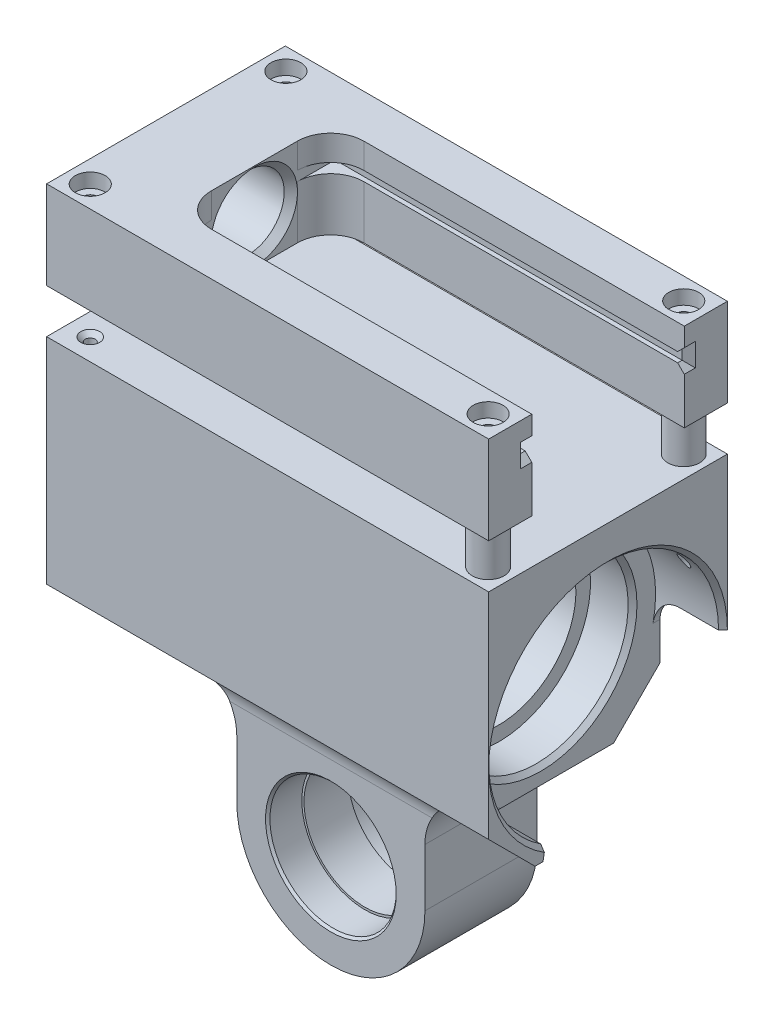
from build123d import *
from OCP.BRepFilletAPI import BRepFilletAPI_MakeFillet

# Parameters (mm, degrees)
SKETCH2_R                                   = 14.28
BOSS_EXTRUDE1_DEPTH                         = 12.7
SKETCH4_W                                   = 100
SKETCH4_H                                   = 59
BOSS_EXTRUDE2_DEPTH                         = 27
SKETCH3_R                                   = 17.5
CUT_EXTRUDE1_DEPTH                          = 134.360413917
SKETCH5_R                                   = 14.28
SKETCH5_R_2                                 = 13.78
BOSS_EXTRUDE3_DEPTH                         = 5
FILLET1_R1                                  = 12
FILLET1_R2                                  = 6
CUT_EXTRUDE2_DEPTH                          = 15.24
SKETCH7_W                                   = 54
SKETCH7_H                                   = 19.938
BOSS_EXTRUDE6_DEPTH                         = 20
BOSS_EXTRUDE7_DEPTH                         = 80
CBORE_FOR_4_BINDING_HEAD_MACHINE_SC_2_COUNT = 2
CBORE_FOR_4_BINDING_HEAD_MACHINE_SC_2_PITCH = 44.25
CBORE_FOR_4_BINDING_HEAD_MACHINE_SC_3_COUNT = 2
CBORE_FOR_4_BINDING_HEAD_MACHINE_SC_3_PITCH = 100.289892312
CBORE_FOR_4_BINDING_HEAD_MACHINE_SC_4_COUNT = 2
CBORE_FOR_4_BINDING_HEAD_MACHINE_SC_4_PITCH = 90
F_4_40_START                                = 60
F_4_40_TAPPED_HOLE1_OUTLINE_R               = 1.1303
F_4_40_TAPPED_HOLE1_DEPTH                   = 25
FILLET2_R                                   = 7.5
SKETCH15_R                                  = 20.7883
CUT_EXTRUDE3_DEPTH                          = 9.525
CHAMFER1_SIZE                               = 1
CUT_EXTRUDE4_START                          = -1.6
SKETCH16_R                                  = 8.25
CUT_EXTRUDE4_DEPTH                          = 153.383336319
SKETCH17_R                                  = 9.165522347
SKETCH17_R_2                                = 3.75
BOSS_EXTRUDE8_DEPTH                         = 1.6
SKETCH18_R                                  = 1
CUT_EXTRUDE5_DEPTH                          = 154.983336319
CHAMFER5_SIZE                               = 1.5
CHAMFER6_SIZE                               = 1.5
FILLET3_R                                   = 5.5
CHAMFER7_SIZE                               = 5.992013882
CHAMFER7_SIZE_2                             = 6
FILLET4_R                                   = 5.5
CHAMFER8_SIZE                               = 1
CHAMFER10_SIZE                              = 1
CHAMFER11_SIZE                              = 0.5
SKETCH19_R                                  = 3.6
SKETCH19_R_2                                = 1.6
BOSS_EXTRUDE9_DEPTH                         = 10
BOSS_EXTRUDE9_2_DEPTH                       = 10


with BuildPart() as part:
    # Sketch2 → Boss-Extrude1 (new, symmetric)
    with BuildSketch(Plane.XY):
        with BuildLine():
            Line((-21.28, 0), (-21.28, 82.28))
            Line((-21.28, 82.28), (21.28, 82.28))
            Line((21.28, 82.28), (21.28, 0))
            ThreePointArc((21.28, 0), (0, -21.28), (-21.28, 0))
        make_face()
        Circle(SKETCH2_R, mode=Mode.SUBTRACT)
    extrude(amount=BOSS_EXTRUDE1_DEPTH, both=True)

    # Sketch4 → Boss-Extrude2 (add, symmetric)
    with BuildSketch(Plane.XY):
        with Locations((0, 54.5)):
            Rectangle(SKETCH4_W, SKETCH4_H)
    extrude(amount=BOSS_EXTRUDE2_DEPTH, both=True)

    # Sketch3 → Cut-Extrude1 (cut, through all)
    with BuildSketch(Plane(origin=(50, 0, 0), x_dir=(0, 0, -1), z_dir=(1, 0, 0))):
        with Locations((0, 49.5)):
            Circle(SKETCH3_R)
    extrude(amount=-CUT_EXTRUDE1_DEPTH, mode=Mode.SUBTRACT)

    # Sketch5 → Boss-Extrude3 (add, symmetric)
    with BuildSketch(Plane.XY):
        Circle(SKETCH5_R)
        Circle(SKETCH5_R_2, mode=Mode.SUBTRACT)
    extrude(amount=BOSS_EXTRUDE3_DEPTH, both=True)

    # Fillet1: one fillet with a radius per group of edges: ONE call of the kernel's fillet builder (fillet() takes one radius for all edges)
    fillet1_edges_1 = [part.edges().sort_by_distance(p)[0] for p in [
        (-21.28, 25, 0),
        (21.28, 25, 0),
    ]]
    fillet1_edges_2 = [part.edges().sort_by_distance(p)[0] for p in [
        (0, 25, 12.7),
        (0, 25, -12.7),
    ]]
    fillet1 = BRepFilletAPI_MakeFillet(part.part.solid().wrapped)
    for e in fillet1_edges_1:
        fillet1.Add(FILLET1_R1, e.wrapped)
    for e in fillet1_edges_2:
        fillet1.Add(FILLET1_R2, e.wrapped)
    add(Compound.cast(fillet1.Shape()), mode=Mode.REPLACE)

    # Sketch6 → Cut-Extrude2 (cut)
    with BuildSketch(Plane.ZY.offset(50)):
        with BuildLine():
            Line((0, 23.5), (0, -0.612195027))
            Line((0, -0.612195027), (-26, -0.612195027))
            Line((-26, -0.612195027), (-31.032905967, -0.612195027))
            Line((-31.032905967, -0.612195027), (-31.032905967, 49.5))
            Line((-31.032905967, 49.5), (-26, 49.5))
            ThreePointArc((-26, 49.5), (18.384776311, 67.884776311), (0, 23.5))
        make_face()
    cut_extrude2 = extrude(amount=-CUT_EXTRUDE2_DEPTH, mode=Mode.SUBTRACT)

    # Mirror1: Cut-Extrude2 across plane
    add(cut_extrude2.mirror(Plane(origin=(0, 0, 0), x_dir=(0, 0, 1), z_dir=(1, 0, 0))), mode=Mode.SUBTRACT)

    # #4-40 Tapped Hole1: read off the stored shape, not the designer's step
    # #4-40 Tapped Hole1 outline → #4-40 Tapped Hole1 (cut)
    with BuildSketch(Plane(origin=(0, 0, 0), x_dir=(1, 0, 0), z_dir=(0, 1, 0)).offset(F_4_40_START)):
        with Locations((45, -22.125)):
            Circle(F_4_40_TAPPED_HOLE1_OUTLINE_R)
        with Locations((45, 22.125)):
            Circle(F_4_40_TAPPED_HOLE1_OUTLINE_R)
        with Locations((-45, -22.125)):
            Circle(F_4_40_TAPPED_HOLE1_OUTLINE_R)
        with Locations((-45, 22.125)):
            Circle(F_4_40_TAPPED_HOLE1_OUTLINE_R)
    extrude(amount=F_4_40_TAPPED_HOLE1_DEPTH, mode=Mode.SUBTRACT)

    # Sketch15 → Cut-Extrude3 (cut)
    with BuildSketch(Plane(origin=(34.76, 0, 0), x_dir=(0, 0, -1), z_dir=(1, 0, 0))):
        with Locations(Location((0, 49.5, 0), (0, 0, 90))):
            Circle(SKETCH15_R)
    cut_extrude3 = extrude(amount=-CUT_EXTRUDE3_DEPTH, mode=Mode.SUBTRACT)

    # Mirror2: Cut-Extrude3 across plane
    add(cut_extrude3.mirror(Plane(origin=(0, 0, 0), x_dir=(0, 0, 1), z_dir=(1, 0, 0))), mode=Mode.SUBTRACT)

    # Chamfer1
    chamfer1_edges = [part.edges().sort_by_distance(p)[0] for p in [
        (34.76, 28.7117, 0),
        (-34.76, 28.7117, 0),
    ]]
    chamfer(chamfer1_edges, length=CHAMFER1_SIZE)

    # Chamfer3
    # the kernel refuses this chamfer: 10.5 mm, written as the material it takes off along each edge
    with BuildSketch(Plane(origin=(82.302052332, 25, 27), x_dir=(0, 0, -1), z_dir=(-1, 0, 0))) as chamfer3_piece_1:
        with BuildLine():
            Line((12.727386361, 2.227386361), (-2.227386361, -12.727386361))
            Line((-2.227386361, -12.727386361), (-3.802386361, -12.727386361))
            ThreePointArc((-3.802386361, -12.727386361), (-1.575, -6.36369318), (-1.575, 0))
            Line((-1.575, 0), (0, 1.575))
            ThreePointArc((0, 1.575), (6.36369318, 1.575), (12.727386361, 3.802386361))
            Line((12.727386361, 3.802386361), (12.727386361, 2.227386361))
        make_face()
    extrude(amount=164.604104664, mode=Mode.SUBTRACT)
    with BuildSketch(Plane(origin=(67.062052332, 25, -27), x_dir=(0, 0, 1), z_dir=(-1, 0, 0))) as chamfer3_piece_2:
        with BuildLine():
            Line((12.727386361, -2.227386361), (-2.227386361, 12.727386361))
            Line((-2.227386361, 12.727386361), (-3.802386361, 12.727386361))
            ThreePointArc((-3.802386361, 12.727386361), (-1.575, 6.36369318), (-1.575, 0))
            Line((-1.575, 0), (0, -1.575))
            ThreePointArc((0, -1.575), (6.36369318, -1.575), (12.727386361, -3.802386361))
            Line((12.727386361, -3.802386361), (12.727386361, -2.227386361))
        make_face()
    extrude(amount=134.124104664, mode=Mode.SUBTRACT)

    # Fillet3
    fillet3_edges = [part.edges().sort_by_distance(p)[0] for p in [
        (-34.76, 49.5, -26.5),
        (34.76, 49.5, -26.5),
    ]]
    fillet(fillet3_edges, radius=FILLET3_R)

    # Chamfer7
    # the kernel refuses this chamfer: 6, 5.992013882 mm, written as the material it takes off along each edge
    with BuildSketch(Plane(origin=(-34.76, 25, 8.703447593), x_dir=(0, 0, 1), z_dir=(-1, 0, 0))) as chamfer7_piece_1:
        with BuildLine():
            Line((CHAMFER7_SIZE, 0), (5.530305418, 2.742236438))
            ThreePointArc((5.530305418, 2.742236438), (2.878279334, 1.222036142), (0, 0))
            Line((0, 0), (CHAMFER7_SIZE, 0))
        make_face()
    extrude(amount=30.856297971, mode=Mode.SUBTRACT)
    with BuildSketch(Plane(origin=(34.76, 25, 8.703447593), x_dir=(0, 0, 1), z_dir=(1, 0, 0))) as chamfer7_piece_2:
        with BuildLine():
            Line((CHAMFER7_SIZE_2, 0), (5.517899842, -2.734125859))
            ThreePointArc((5.517899842, -2.734125859), (2.870808424, -1.218320557), (0, 0))
            Line((0, 0), (CHAMFER7_SIZE_2, 0))
        make_face()
    extrude(amount=30.81497635, mode=Mode.SUBTRACT)

    # Fillet4
    fillet4_edges = [part.edges().sort_by_distance(p)[0] for p in [
        (-34.76, 26.371118219, 14.464607243),
        (34.76, 26.367062929, 14.462397514),
    ]]
    fillet(fillet4_edges, radius=FILLET4_R)

    # Chamfer8
    chamfer8_edges = [part.edges().sort_by_distance(p)[0] for p in [
        (50, 72.366515184, 12.374266982),
        (-50, 72.370041302, 12.367748819),
    ]]
    chamfer(chamfer8_edges, length=CHAMFER8_SIZE - 0.0001)  # a hair under: the kernel refuses the full size

    # Chamfer10
    chamfer10_edges = [part.edges().sort_by_distance(p)[0] for p in [
        (43.8697, 84, 22.125),
        (43.8697, 84, -22.125),
        (-46.1303, 84, 22.125),
        (-46.1303, 84, -22.125),
    ]]
    chamfer(chamfer10_edges, length=CHAMFER10_SIZE)

    # Chamfer11
    chamfer11_edges = [part.edges().sort_by_distance(p)[0] for p in [
        (-14.28, 0, -12.7),
        (-14.28, 0, 12.7),
    ]]
    chamfer(chamfer11_edges, length=CHAMFER11_SIZE)


with BuildPart() as body_2:
    # Sketch7 → Boss-Extrude6 (new body)
    with BuildSketch(Plane.ZY.offset(50)):
        with Locations((0, 103.969)):
            Rectangle(SKETCH7_W, SKETCH7_H)
        with BuildLine():
            Line((4.938324412, 109.938), (-4.938324412, 109.938))
            ThreePointArc((-4.938324412, 109.938), (-7.747, 103.969), (-4.938324412, 98))
            Line((-4.938324412, 98), (4.938324412, 98))
            ThreePointArc((4.938324412, 98), (7.747, 103.969), (4.938324412, 109.938))
        make_face(mode=Mode.SUBTRACT)
    extrude(amount=-BOSS_EXTRUDE6_DEPTH)

    # Sketch8 → Boss-Extrude7 (add)
    with BuildSketch(Plane(origin=(-30, 0, 0), x_dir=(0, 0, -1), z_dir=(1, 0, 0))):
        Polygon((27, 94), (27, 113.938), (17.25, 113.938), (17.25, 108.2), (18.25, 108.2), (18.25, 106), (17.25, 106), (17.25, 94), align=None)
        Polygon((-17.25, 94), (-27, 94), (-27, 113.938), (-17.25, 113.938), (-17.25, 108.2), (-18.25, 108.2), (-18.25, 106), (-17.25, 106), align=None)
    extrude(amount=BOSS_EXTRUDE7_DEPTH)

    # Sketch11 → CBORE for #4 Binding Head Machine Screw1 (revolve, cut)
    with BuildSketch(Plane(origin=(-45, 113.938, -22.125), x_dir=(0, 0, 1), z_dir=(1, 0, 0))):
        Polygon((0, 0), (0, 30.917574487), (1.63195, 29.937), (1.63195, 3.227197), (3.37312, 3.227197), (3.37312, 0), align=None)
    cbore_for_4_binding_head_machine_screw1 = revolve(axis=Axis((-45, 120.288, -22.125), (0, -1, 0)), mode=Mode.SUBTRACT)

    # CBORE for _4 Binding Head Machine Sc 2: CBORE for #4 Binding Head Machine Screw1 ×2
    with Locations(*[(0, 0, i * CBORE_FOR_4_BINDING_HEAD_MACHINE_SC_2_PITCH) for i in range(1, CBORE_FOR_4_BINDING_HEAD_MACHINE_SC_2_COUNT)]):
        add(cbore_for_4_binding_head_machine_screw1, mode=Mode.SUBTRACT)

    # CBORE for _4 Binding Head Machine Sc 3: CBORE for #4 Binding Head Machine Screw1 ×2
    with Locations(*[Vector(0.8973985107073343, 0, 0.44122093443110605) * (i * CBORE_FOR_4_BINDING_HEAD_MACHINE_SC_3_PITCH) for i in range(1, CBORE_FOR_4_BINDING_HEAD_MACHINE_SC_3_COUNT)]):
        add(cbore_for_4_binding_head_machine_screw1, mode=Mode.SUBTRACT)

    # CBORE for _4 Binding Head Machine Sc 4: CBORE for #4 Binding Head Machine Screw1 ×2
    with Locations(*[(i * CBORE_FOR_4_BINDING_HEAD_MACHINE_SC_4_PITCH, 0, 0) for i in range(1, CBORE_FOR_4_BINDING_HEAD_MACHINE_SC_4_COUNT)]):
        add(cbore_for_4_binding_head_machine_screw1, mode=Mode.SUBTRACT)

    # Fillet2
    fillet2_edges = [body_2.edges().sort_by_distance(p)[0] for p in [
        (-30, 100, -17.25),
        (-30, 100, 17.25),
        (-30, 111.069, 17.25),
        (-30, 111.069, -17.25),
    ]]
    fillet(fillet2_edges, radius=FILLET2_R)

    # Sketch16 → Cut-Extrude4 (cut, through all)
    with BuildSketch(Plane.ZY.offset(50).offset(CUT_EXTRUDE4_START)):
        with Locations((0, 103.969)):
            Circle(SKETCH16_R)
    extrude(amount=-CUT_EXTRUDE4_DEPTH, mode=Mode.SUBTRACT)

    # Sketch17 → Boss-Extrude8 (add)
    with BuildSketch(Plane.ZY.offset(50)):
        with Locations((0, 103.969)):
            Circle(SKETCH17_R)
        with Locations((0, 103.969)):
            Circle(SKETCH17_R_2, mode=Mode.SUBTRACT)
    extrude(amount=-BOSS_EXTRUDE8_DEPTH)

    # Sketch18 → Cut-Extrude5 (cut, through all)
    with BuildSketch(Plane.ZY.offset(50)):
        with Locations((5.5, 103.969)):
            Circle(SKETCH18_R)
        with Locations((-5.5, 103.969)):
            Circle(SKETCH18_R)
    extrude(amount=-CUT_EXTRUDE5_DEPTH, mode=Mode.SUBTRACT)

    # Chamfer5
    chamfer5_edges = [body_2.edges().sort_by_distance(p)[0] for p in [
        (50, 106, -17.75),
        (50, 107.1, -18.25),
        (50, 108.2, -17.75),
        (50, 108.2, 17.75),
        (50, 107.1, 18.25),
        (50, 106, 17.75),
    ]]
    chamfer(chamfer5_edges, length=CHAMFER5_SIZE)

    # Chamfer6
    chamfer6_edges = [body_2.edges().sort_by_distance(p)[0] for p in [
        (-30, 103.969, -8.25),
    ]]
    chamfer(chamfer6_edges, length=CHAMFER6_SIZE - 0.0001)  # a hair under: the kernel refuses the full size


with BuildPart() as body_3:
    # Sketch19 → Boss-Extrude9 (new body)
    with BuildSketch(Plane(origin=(0, 84, 0), x_dir=(1, 0, 0), z_dir=(0, 1, 0))):
        with Locations(Location((45, -22.125, 0), (0, 0, 90))):
            Circle(SKETCH19_R)
        with Locations(Location((45, -22.125, 0), (0, 0, 90))):
            Circle(SKETCH19_R_2, mode=Mode.SUBTRACT)
    extrude(amount=BOSS_EXTRUDE9_DEPTH)


with BuildPart() as body_4:
    # Sketch19 → Boss-Extrude9 2 (new body)
    with BuildSketch(Plane(origin=(0, 84, 0), x_dir=(1, 0, 0), z_dir=(0, 1, 0))):
        with Locations(Location((45, 22.125, 0), (0, 0, 90))):
            Circle(SKETCH19_R)
        with Locations(Location((45, 22.125, 0), (0, 0, 90))):
            Circle(SKETCH19_R_2, mode=Mode.SUBTRACT)
    extrude(amount=BOSS_EXTRUDE9_2_DEPTH)


solid = Compound([part.part, body_2.part, body_3.part, body_4.part])
